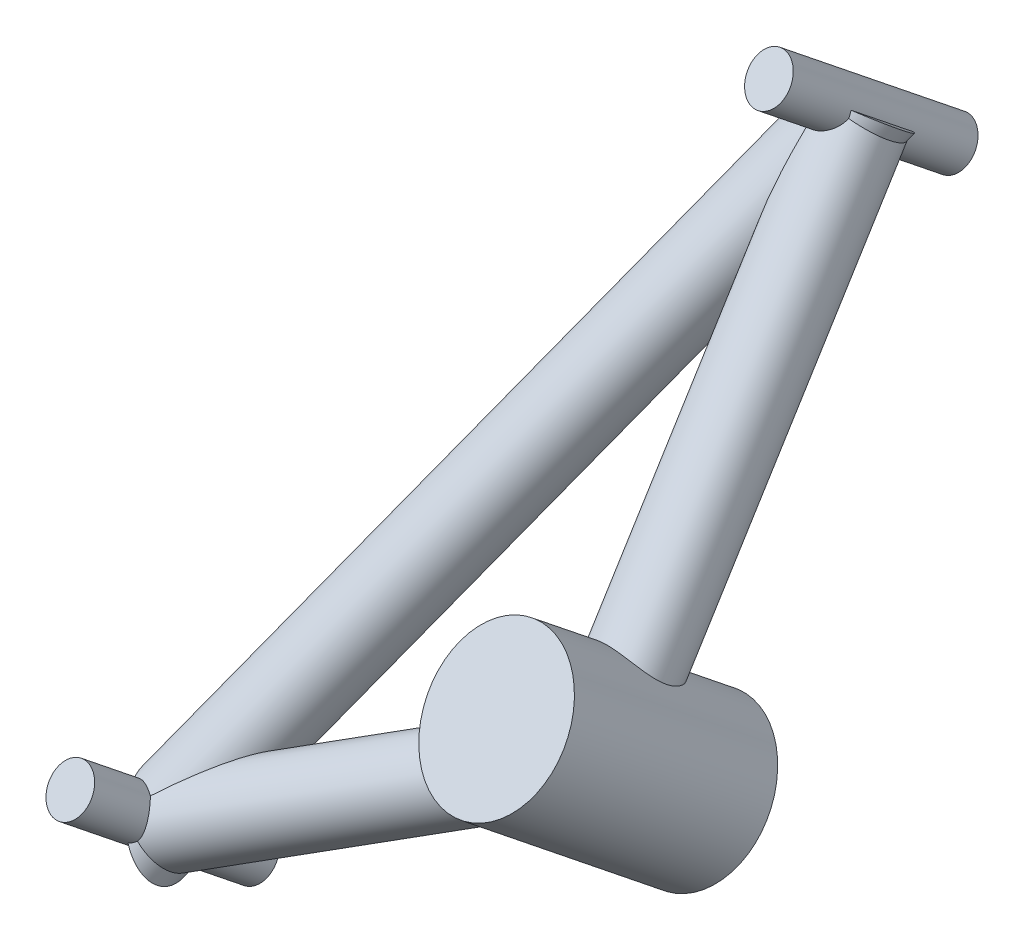
from build123d import *

# Parameters (mm, degrees)
SUSP_FL_ROCKER_BOSS_PROFILE_R        = 16
SUSP_FL_ROCKER_ARM_ROD_PROFILE_R     = 8
SUSP_FL_ROCKER_ARM_DAMPER_PROFILE_R  = 8
SUSP_FL_ROCKER_EDGE_START            = -349.603515497
SUSP_FL_ROCKER_EDGE_OUTLINE_R        = 8
SUSP_FL_ROCKER_EDGE_DEPTH            = 173.641800609
SUSP_FL_ROCKER_EDGE_START_2          = 156
SUSP_FL_ROCKER_EDGE_2_DEPTH          = 18
SUSP_FL_ROCKER_BOLT_ROD_PROFILE_R    = 5
SUSP_FL_ROCKER_BOLT_DAMPER_PROFILE_R = 5


with BuildPart() as part:
    # SUSP_FL_rocker_boss: sweep along a curve in space
    with BuildLine() as susp_fl_rocker_boss_path:
        Line((-254.500188, -246.605638, -58.2344508), (-246.179812, -272.574362, -92.7655492))
    # SUSP_FL_rocker_boss profile (on start of the path) → SUSP_FL_rocker_boss (sweep)
    with BuildSketch(Plane(origin=(-254.500188, -246.605638, -58.2344508), x_dir=(0, -0.799217207226954, 0.6010423077224667), z_dir=(0.18909945260757435, -0.5901982666789547, -0.7847976828665292))):
        Circle(SUSP_FL_ROCKER_BOSS_PROFILE_R)
    sweep(path=susp_fl_rocker_boss_path.line)

    # SUSP_FL_rocker_arm_rod: sweep along a curve in space
    with BuildLine() as susp_fl_rocker_arm_rod_path:
        Line((-250.34, -259.59, -75.5), (-327.8055, -303.4911, -61.1463))
    # SUSP_FL_rocker_arm_rod profile (on start of the path) → SUSP_FL_rocker_arm_rod (sweep)
    with BuildSketch(Plane(origin=(-250.34, -259.59, -75.5), x_dir=(0.49304643416260663, -0.8700029964083678, 0), z_dir=(-0.85891436200706, -0.4867623044827459, 0.1591495449966853))):
        Circle(SUSP_FL_ROCKER_ARM_ROD_PROFILE_R)
    sweep(path=susp_fl_rocker_arm_rod_path.line)

    # SUSP_FL_rocker_arm_damper: sweep along a curve in space
    with BuildLine() as susp_fl_rocker_arm_damper_path:
        Line((-250.34, -259.59, -75.5), (-258.2941, -177.8144, -138.9163))
    # SUSP_FL_rocker_arm_damper profile (on start of the path) → SUSP_FL_rocker_arm_damper (sweep)
    with BuildSketch(Plane(origin=(-250.34, -259.59, -75.5), x_dir=(0, 0.6128143939771712, 0.7902268778865931), z_dir=(-0.0766372619667529, 0.787902852577713, -0.6110121316129019))):
        Circle(SUSP_FL_ROCKER_ARM_DAMPER_PROFILE_R)
    sweep(path=susp_fl_rocker_arm_damper_path.line)

    # SUSP_FL_rocker_edge: read off the stored shape, not the designer's step
    # SUSP_FL_rocker_edge outline → SUSP_FL_rocker_edge (add)
    with BuildSketch(Plane(origin=(0, 0, 0), x_dir=(0.9049090352812189, -0.3619156002398248, 0.22395699625030885), z_dir=(0.4256050256592532, 0.7694944300973692, -0.47617085608288917)).offset(SUSP_FL_ROCKER_EDGE_START)):
        with Locations((-200.490136821, 211.695702775)):
            Circle(SUSP_FL_ROCKER_EDGE_OUTLINE_R)
    extrude(amount=SUSP_FL_ROCKER_EDGE_DEPTH)

    # SUSP_FL_rocker_edge 2 outline → SUSP_FL_rocker_edge 2 (cut)
    with BuildSketch(Plane(origin=(0, 0, 0), x_dir=(0.9819640167771745, 0.11363972708234288, 0.151104871475037), z_dir=(0.18906789720848124, -0.5902119001629937, -0.7847950325729333)).offset(SUSP_FL_ROCKER_EDGE_START_2)):
        Polygon((-285.608779181, 57.892860248), (-304.0576638, 59.33710637), (-377, 65.047299065), (-377, 49), (-304.099214188, 49), (-300.02783482, 50.958104702), align=None)
        Polygon((-377, 206.619176869), (-377, 185.2661877), (-370.373716001, 197.224424853), (-360.868994159, 214.377284265), (-375.288049799, 207.44252872), align=None)
    extrude(amount=SUSP_FL_ROCKER_EDGE_2_DEPTH, mode=Mode.SUBTRACT)

    # SUSP_FL_rocker_bolt_rod: sweep along a curve in space
    with BuildLine() as susp_fl_rocker_bolt_rod_path:
        Line((-331.587489, -291.687135, -45.4503462), (-324.023511, -315.295065, -76.8422538))
    # SUSP_FL_rocker_bolt_rod profile (on start of the path) → SUSP_FL_rocker_bolt_rod (sweep)
    with BuildSketch(Plane(origin=(-331.587489, -291.687135, -45.4503462), x_dir=(0, -0.799217218010449, 0.6010422933834509), z_dir=(0.18909945089607666, -0.5901982527967419, -0.7847976937188816))):
        Circle(SUSP_FL_ROCKER_BOLT_ROD_PROFILE_R)
    sweep(path=susp_fl_rocker_bolt_rod_path.line)

    # SUSP_FL_rocker_bolt_damper: sweep along a curve in space
    with BuildLine() as susp_fl_rocker_bolt_damper_path:
        Line((-262.076089, -166.010435, -123.220346), (-254.512111, -189.618365, -154.612254))
    # SUSP_FL_rocker_bolt_damper profile (on start of the path) → SUSP_FL_rocker_bolt_damper (sweep)
    with BuildSketch(Plane(origin=(-262.076089, -166.010435, -123.220346), x_dir=(0, -0.7992172216893416, 0.6010422884915585), z_dir=(0.18909944941202897, -0.5901982481648803, -0.7847976975598068))):
        Circle(SUSP_FL_ROCKER_BOLT_DAMPER_PROFILE_R)
    sweep(path=susp_fl_rocker_bolt_damper_path.line)


solid = part.part
